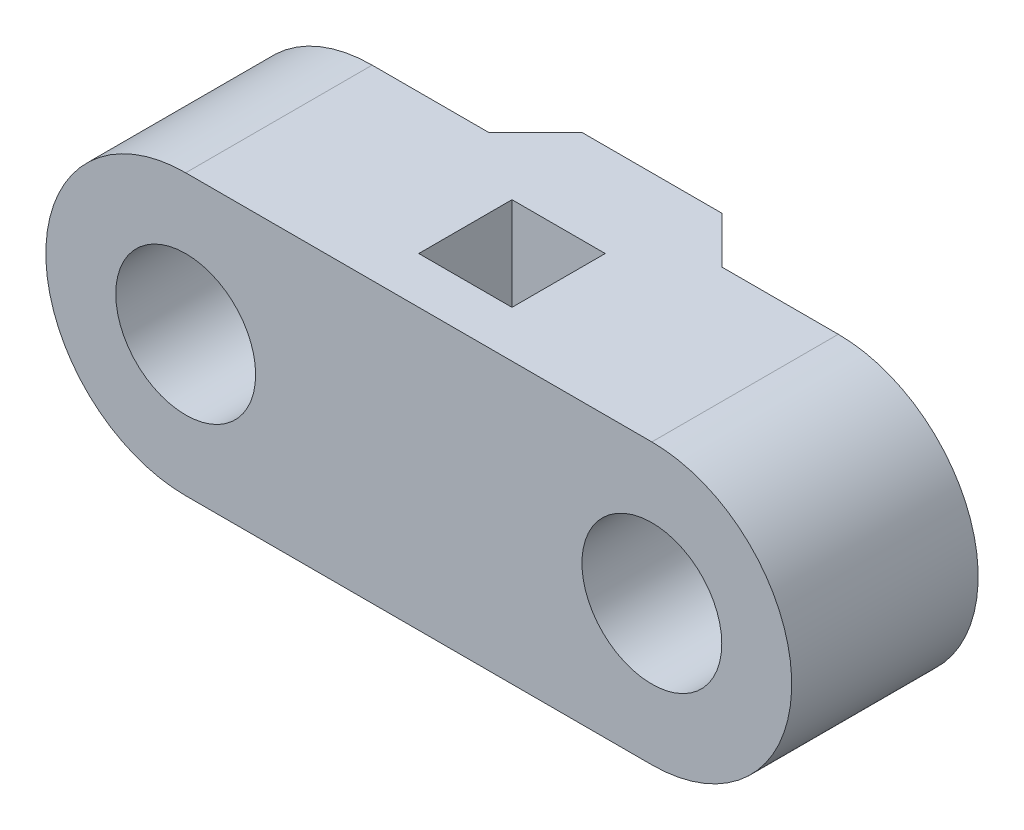
from build123d import *

# Parameters (mm, degrees)
SKETCH1_W               = 20
SKETCH1_H               = 20
BOSS_EXTRUDE1_DEPTH     = 60
CUT_EXTRUDE1_DEPTH      = 105.403065089
CUT_EXTRUDE1_DEPTH_BACK = 105.403065089
SKETCH2_R               = 15
CHAMFER2_SIZE           = 10


with BuildPart() as part:
    # Sketch1 → Boss-Extrude1 (new body)
    with BuildSketch(Plane(origin=(0, 0, 0), x_dir=(1, 0, 0), z_dir=(0, 1, 0))):
        Polygon((-15, 30), (15, 30), (15, 20), (80, 20), (80, -20), (-80, -20), (-80, 20), (-15, 20), align=None)
        Rectangle(SKETCH1_W, SKETCH1_H, mode=Mode.SUBTRACT)
    extrude(amount=BOSS_EXTRUDE1_DEPTH)

    # Sketch2 → Cut-Extrude1 (cut, two sides: drawn at the far end of the back side and taken through both)
    with BuildSketch(Plane.XY.offset(-CUT_EXTRUDE1_DEPTH_BACK)):
        with Locations((50, 30)):
            Circle(SKETCH2_R)
        with Locations((-50, 30)):
            Circle(SKETCH2_R)
        with BuildLine():
            Line((-50, 60), (-50, 75.524643477))
            Line((-50, 75.524643477), (-102.669470588, 75.524643477))
            Line((-102.669470588, 75.524643477), (-102.669470588, -8.464278737))
            Line((-102.669470588, -8.464278737), (-50, -8.464278737))
            Line((-50, -8.464278737), (-50, 0))
            ThreePointArc((-50, 0), (-80, 30), (-50, 60))
        make_face()
        with BuildLine():
            Line((102.669470588, -8.464278737), (50, -8.464278737))
            Line((50, -8.464278737), (50, 0))
            ThreePointArc((50, 0), (80, 30), (50, 60))
            Line((50, 60), (50, 75.524643477))
            Line((50, 75.524643477), (102.669470588, 75.524643477))
            Line((102.669470588, 75.524643477), (102.669470588, -8.464278737))
        make_face()
    extrude(amount=CUT_EXTRUDE1_DEPTH + CUT_EXTRUDE1_DEPTH_BACK, mode=Mode.SUBTRACT)

    # Chamfer2
    chamfer2_edges = [part.edges().sort_by_distance(p)[0] for p in [
        (15, 30, -20),
        (-15, 30, -20),
    ]]
    chamfer(chamfer2_edges, length=CHAMFER2_SIZE - 0.0001)  # a hair under: the kernel refuses the full size


solid = part.part
